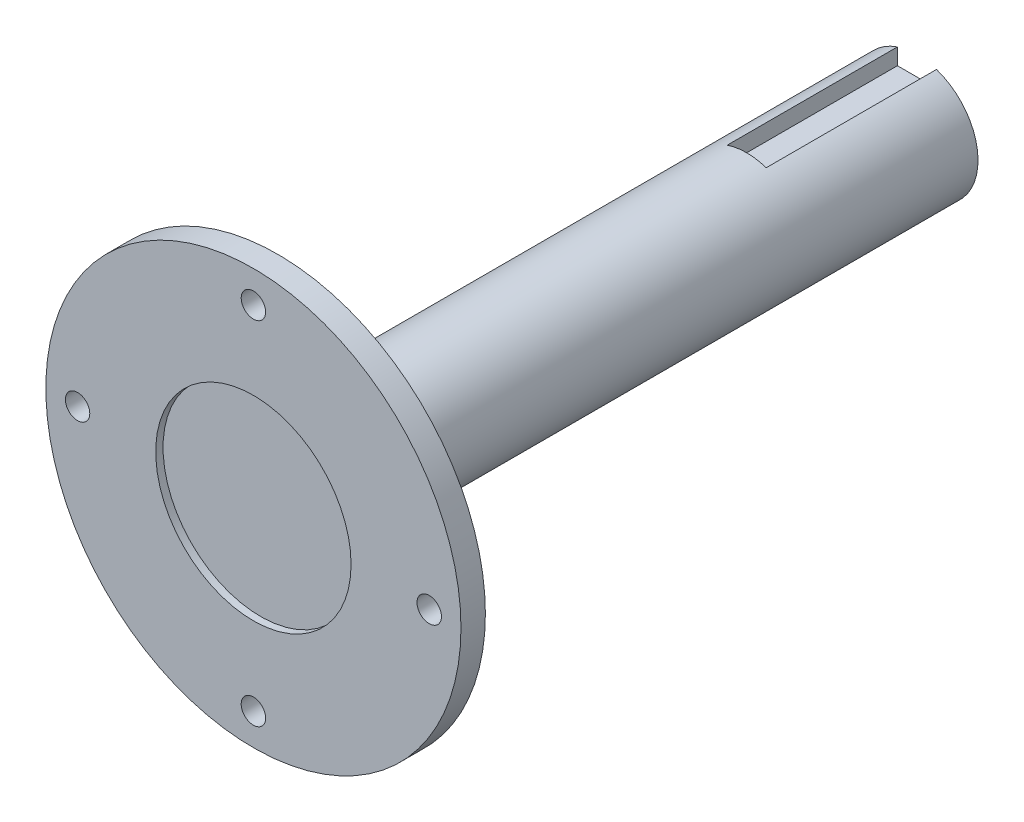
from build123d import *

# Parameters (mm, degrees)
SKETCH1_R                 = 12.5
BOSS_EXTRUDE1_DEPTH       = 119.4
SKETCH4_W                 = 8
SKETCH4_H                 = 8
CUT_EXTRUDE1_DEPTH        = 35.4
SKETCH5_R                 = 15.3
BOSS_EXTRUDE2_DEPTH       = 2
SKETCH10_R                = 12.5
BOSS_EXTRUDE5_DEPTH       = 15
SKETCH14_R                = 12.5
CUT_EXTRUDE3_DEPTH        = 0.53629326
M6X1_0_TAPPED_HOLE2_D     = 5
M6X1_0_TAPPED_HOLE2_DEPTH = 18.497848452
M6X1_0_TAPPED_HOLE2_TIP   = 1.502151548
SKETCH20_R                = 42.5
BOSS_EXTRUDE6_DEPTH       = 5
FILLET3_R                 = 10
M6X1_0_TAPPED_HOLE3_D     = 5
SKETCH23_R                = 20
CUT_EXTRUDE4_DEPTH        = 1.5


with BuildPart() as part:
    # Sketch1 → Boss-Extrude1 (new body)
    with BuildSketch(Plane.XY):
        Circle(SKETCH1_R)
    extrude(amount=BOSS_EXTRUDE1_DEPTH)

    # Sketch4 → Cut-Extrude1 (cut)
    with BuildSketch(Plane(origin=(0, 0, 0), x_dir=(-1, 0, 0), z_dir=(0, 0, -1))):
        with Locations((0, 12.5)):
            Rectangle(SKETCH4_W, SKETCH4_H)
    extrude(amount=-CUT_EXTRUDE1_DEPTH, mode=Mode.SUBTRACT)

    # Sketch5 → Boss-Extrude2 (add)
    with BuildSketch(Plane.XY.offset(119.4)):
        Circle(SKETCH5_R)
    extrude(amount=BOSS_EXTRUDE2_DEPTH)

    # Sketch10 → Boss-Extrude5 (add)
    with BuildSketch(Plane.XY.offset(121.4)):
        with Locations(Location((0, 0, 0), (0, 0, 108.662924885))):
            Circle(SKETCH10_R)
    extrude(amount=BOSS_EXTRUDE5_DEPTH)

    # Sketch14 → Cut-Extrude3 (cut)
    with BuildSketch(Plane(origin=(0, 0, 0), x_dir=(-1, 0, 0), z_dir=(0, 0, -1))):
        with Locations(Location((0, 0, 0), (0, 0, 71.337075115))):
            Circle(SKETCH14_R)
    extrude(amount=-CUT_EXTRUDE3_DEPTH, mode=Mode.SUBTRACT)

    # M6x1.0 Tapped Hole2
    with Locations(Plane(origin=(0, 0, 0.53629326), x_dir=(-1, 0, 0), z_dir=(0, 0, -1))):
        with Locations((0, 0)):
            Hole(M6X1_0_TAPPED_HOLE2_D / 2, depth=M6X1_0_TAPPED_HOLE2_DEPTH)
            with Locations((0, 0, -(M6X1_0_TAPPED_HOLE2_DEPTH + M6X1_0_TAPPED_HOLE2_TIP / 2))):  # 118° drill point
                Cone(0, M6X1_0_TAPPED_HOLE2_D / 2, M6X1_0_TAPPED_HOLE2_TIP, mode=Mode.SUBTRACT)

    # Sketch20 → Boss-Extrude6 (add)
    with BuildSketch(Plane.XY.offset(136.4)):
        Circle(SKETCH20_R)
    extrude(amount=-BOSS_EXTRUDE6_DEPTH)

    # Fillet3
    fillet3_edges = [part.edges().sort_by_distance(p)[0] for p in [
        (4, -11.842719282, 131.4),
    ]]
    fillet(fillet3_edges, radius=FILLET3_R - 0.0001)  # a hair under: the kernel refuses the full size

    # M6x1.0 Tapped Hole3 (through all)
    with Locations(Plane.XY.offset(136.4)):
        with Locations((0, 36), (36, 0), (0, -36), (-36, 0)):
            Hole(M6X1_0_TAPPED_HOLE3_D / 2)

    # Sketch23 → Cut-Extrude4 (cut)
    with BuildSketch(Plane.XY.offset(136.4)):
        Circle(SKETCH23_R)
    extrude(amount=-CUT_EXTRUDE4_DEPTH, mode=Mode.SUBTRACT)


solid = part.part
